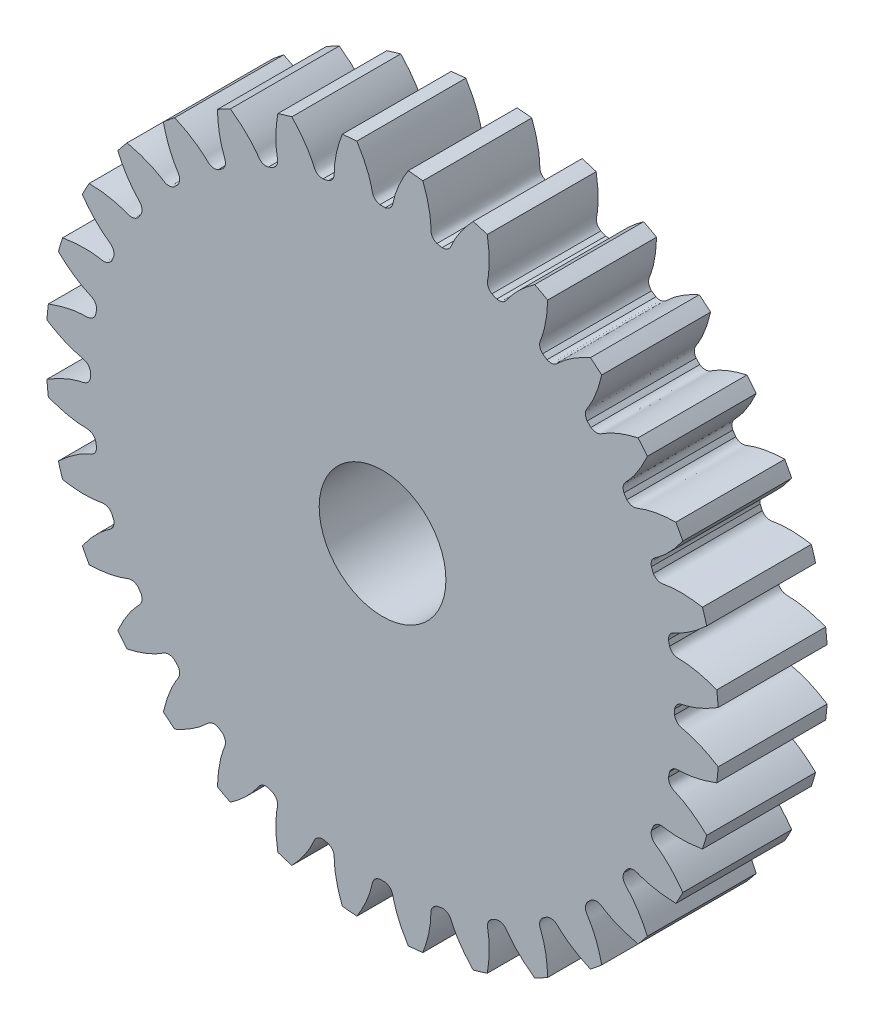
from build123d import *

# Parameters (mm, degrees)
SKETCH_1_R               = 8.5
EXTRUDE_1_DEPTH          = 2.75
CUT_EXTRUDE_1_DEPTH      = 13.331362455
PATTERN_CIRCULAR_1_COUNT = 32
CUT_EXTRUDE_2_REACH      = 14.297
SKETCH_4_R               = 1.6


with BuildPart() as part:
    # 草图1 → 凸台-拉伸1 (new body)
    with BuildSketch(Plane.XY):
        Circle(SKETCH_1_R)
    extrude(amount=EXTRUDE_1_DEPTH)

    # 草图2 → 切除-拉伸1 (cut, through all)
    with BuildSketch(Plane.XY):
        with BuildLine():
            ThreePointArc((0.067016057, 7.374695509), (0, 7.375), (-0.067016057, 7.374695509))
            add(Edge.make_bspline(
                [(-0.067016057, 7.374695509), (-0.244409752, 7.417585205), (-0.254185421, 7.546206625), (-0.286714327, 7.680381026), (-0.295183058, 7.71268082), (-0.305128683, 7.747692877), (-0.31664673, 7.785376713), (-0.32985255, 7.825680217), (-0.344853694, 7.868550436), (-0.361758143, 7.913930361), (-0.380671731, 7.961759942), (-0.401698795, 8.011975833), (-0.424941869, 8.064511528), (-0.450501667, 8.119297378), (-0.478476978, 8.176260642), (-0.508964584, 8.235325541), (-0.542059185, 8.296413305), (-0.577853311, 8.359442229), (-0.616437247, 8.424327727), (-0.657898954, 8.490982392), (-0.702323991, 8.559316051), (-0.749795443, 8.629235832), (-0.800393843, 8.700646224), (-0.854197106, 8.773449143), (-0.911280452, 8.847543999), (-0.971716342, 8.922827763), (-1.035574408, 8.999195043), (-1.102921392, 9.07653815), (-1.173821075, 9.154747175), (-1.248334222, 9.233710065), (-1.326518523, 9.313312698), (-1.40842851, 9.393438964), (-1.524138832, 9.502187768), (-1.614498649, 9.582084996), (-1.676516268, 9.63480345)],
                knots=[0, 0, 0, 0, 0.124532679, 0.135328735, 0.147193327, 0.160126453, 0.174128116, 0.189198313, 0.205337046, 0.222544314, 0.240820117, 0.260164456, 0.28057733, 0.302058739, 0.324608684, 0.348227164, 0.372914179, 0.39866973, 0.425493816, 0.453386438, 0.482347595, 0.512377287, 0.543475514, 0.575642277, 0.608877575, 0.643181408, 0.678553777, 0.714994681, 0.752504121, 0.791082096, 0.830728606, 0.871443651, 0.913227232, 1, 1, 1, 1], degree=3))
            ThreePointArc((-1.676516268, 9.63480345), (0, 9.779577922), (1.676516268, 9.63480345))
            add(Edge.make_bspline(
                [(0.067016057, 7.374695509), (0.244409752, 7.417585205), (0.254185421, 7.546206625), (0.286714327, 7.680381026), (0.295183058, 7.71268082), (0.305128683, 7.747692877), (0.31664673, 7.785376713), (0.32985255, 7.825680217), (0.344853694, 7.868550436), (0.361758143, 7.913930361), (0.380671731, 7.961759942), (0.401698795, 8.011975833), (0.424941869, 8.064511528), (0.450501667, 8.119297378), (0.478476978, 8.176260642), (0.508964584, 8.235325541), (0.542059185, 8.296413305), (0.577853311, 8.359442229), (0.616437247, 8.424327727), (0.657898954, 8.490982392), (0.702323991, 8.559316051), (0.749795443, 8.629235832), (0.800393843, 8.700646224), (0.854197106, 8.773449143), (0.911280452, 8.847543999), (0.971716342, 8.922827763), (1.035574408, 8.999195043), (1.102921392, 9.07653815), (1.173821075, 9.154747175), (1.248334222, 9.233710065), (1.326518523, 9.313312698), (1.40842851, 9.393438964), (1.524138832, 9.502187768), (1.614498649, 9.582084996), (1.676516268, 9.63480345)],
                knots=[0, 0, 0, 0, 0.124532679, 0.135328735, 0.147193327, 0.160126453, 0.174128116, 0.189198313, 0.205337046, 0.222544314, 0.240820117, 0.260164456, 0.28057733, 0.302058739, 0.324608684, 0.348227164, 0.372914179, 0.39866973, 0.425493816, 0.453386438, 0.482347595, 0.512377287, 0.543475514, 0.575642277, 0.608877575, 0.643181408, 0.678553777, 0.714994681, 0.752504121, 0.791082096, 0.830728606, 0.871443651, 0.913227232, 1, 1, 1, 1], degree=3))
        make_face()
    cut_extrude_1 = extrude(amount=CUT_EXTRUDE_1_DEPTH, mode=Mode.SUBTRACT)

    # 阵列(圆周)1: 切除-拉伸1 ×32 about axis
    pattern_circular_1_axis = Axis((0, 0, 2.75), (0, 0, -1))
    for i in range(1, PATTERN_CIRCULAR_1_COUNT):
        add(cut_extrude_1.rotate(pattern_circular_1_axis, i * 360 / PATTERN_CIRCULAR_1_COUNT), mode=Mode.SUBTRACT)

    # 草图4 → 切除-拉伸2 (cut, up to next)
    with BuildSketch(Plane(origin=(0, 0, 0), x_dir=(-1, 0, 0), z_dir=(0, 0, -1)), mode=Mode.PRIVATE) as cut_extrude_2_sk1:
        Circle(SKETCH_4_R)
    cut_extrude_2_tool1 = extrude(cut_extrude_2_sk1.sketch, amount=-CUT_EXTRUDE_2_REACH, mode=Mode.PRIVATE) & part.part
    add(cut_extrude_2_tool1.solids().sort_by_distance((0, 0, 0))[0], mode=Mode.SUBTRACT)


solid = part.part
